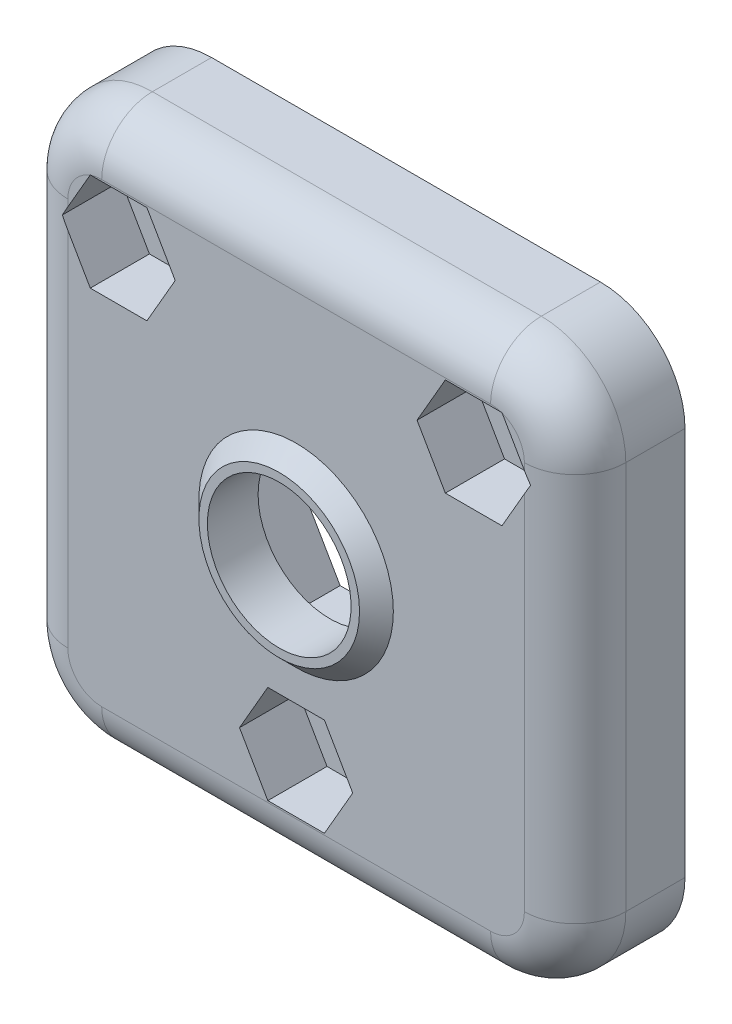
from build123d import *

# Parameters (mm, degrees)
ESBO_O1_R                = 1.75
RESSALTO_EXTRUS_O1_DEPTH = 6.5
CORTE_EXTRUS_O1_DEPTH    = 3.5
CORTE_EXTRUS_O2_DEPTH    = 4.5
ESBO_O3_3_R              = 4.25
CORTE_EXTRUS_O3_DEPTH    = 33.30325061
ESBO_O4_R                = 5.75
ESBO_O4_R_2              = 4.25
RESSALTO_EXTRUS_O2_DEPTH = 1
CHANFRO1_SIZE            = 1
FILETE1_R                = 3


# Some blends are built 0.0001 mm under size
with BuildPart() as part:
    # Esboço1 → Ressalto-extrusão1 (new body)
    with BuildSketch(Plane.XY):
        with BuildLine():
            Line((-11.5, -6), (11.5, -6))
            ThreePointArc((11.5, -6), (15.035533906, -4.535533906), (16.5, -1))
            Line((16.5, -1), (16.5, 22))
            ThreePointArc((16.5, 22), (15.035533906, 25.535533906), (11.5, 27))
            Line((11.5, 27), (-11.5, 27))
            ThreePointArc((-11.5, 27), (-15.035533906, 25.535533906), (-16.5, 22))
            Line((-16.5, 22), (-16.5, -1))
            ThreePointArc((-16.5, -1), (-15.035533906, -4.535533906), (-11.5, -6))
        make_face()
        with Locations(Location((0, 0, 0), (0, 0, 180))):
            Circle(ESBO_O1_R, mode=Mode.SUBTRACT)
        with Locations(Location((-10.5, 21, 0), (0, 0, 180))):
            Circle(ESBO_O1_R, mode=Mode.SUBTRACT)
        with Locations(Location((10.5, 21, 0), (0, 0, 180))):
            Circle(ESBO_O1_R, mode=Mode.SUBTRACT)
    extrude(amount=RESSALTO_EXTRUS_O1_DEPTH)

    # Esboço2 → Corte-extrusão1 (cut)
    with BuildSketch(Plane.XY.offset(6.5)):
        Polygon((-12.174315781, 18.1), (-8.825684219, 18.1), (-7.151368439, 21), (-8.825684219, 23.9), (-12.174315781, 23.9), (-13.848631561, 21), align=None)
        Polygon((8.825684219, 18.1), (12.174315781, 18.1), (13.848631561, 21), (12.174315781, 23.9), (8.825684219, 23.9), (7.151368439, 21), align=None)
        Polygon((-1.674315781, 2.9), (-3.348631561, 0), (-1.674315781, -2.9), (1.674315781, -2.9), (3.348631561, 0), (1.674315781, 2.9), align=None)
    extrude(amount=-CORTE_EXTRUS_O1_DEPTH, mode=Mode.SUBTRACT)

    # Esboço3 → Corte-extrusão2 (cut)
    with BuildSketch(Plane(origin=(0, 0, 0), x_dir=(-1, 0, 0), z_dir=(0, 0, -1))):
        Polygon((3.897114317, 17.25), (-3.897114317, 17.25), (-7.794228634, 10.5), (-3.897114317, 3.75), (3.897114317, 3.75), (7.794228634, 10.5), align=None)
    extrude(amount=-CORTE_EXTRUS_O2_DEPTH, mode=Mode.SUBTRACT)

    # Esboço3<3> → Corte-extrusão3 (cut, through all)
    with BuildSketch(Plane(origin=(0, 0, 0), x_dir=(-1, 0, 0), z_dir=(0, 0, -1))):
        with Locations((0, 10.5)):
            Circle(ESBO_O3_3_R)
    extrude(amount=-CORTE_EXTRUS_O3_DEPTH, mode=Mode.SUBTRACT)

    # Esboço4 → Ressalto-extrusão2 (add)
    with BuildSketch(Plane.XY.offset(6.5)):
        with Locations((0, 10.5)):
            Circle(ESBO_O4_R)
        with Locations(Location((0, 10.5, 0), (0, 0, 180))):
            Circle(ESBO_O4_R_2, mode=Mode.SUBTRACT)
    extrude(amount=RESSALTO_EXTRUS_O2_DEPTH)

    # Chanfro1
    chanfro1_edges = [part.edges().sort_by_distance(p)[0] for p in [
        (-5.75, 10.5, 7.5),
    ]]
    chamfer(chanfro1_edges, length=CHANFRO1_SIZE - 0.0001)  # a hair under: the kernel refuses the full size

    # Filete1
    # the kernel refuses this fillet: 3 mm, written as the material it takes off along each edge
    with BuildSketch(Plane(origin=(11.5, 22, 6.5), x_dir=(1, 0, 0), z_dir=(0, -1, 0))) as filete1_piece_1:
        with BuildLine():
            CenterArc((5 - FILETE1_R, -FILETE1_R), FILETE1_R, 0, 90)
            Line((5, -FILETE1_R), (5, 0))
            Line((5, 0), (5 - FILETE1_R, 0))
        make_face()
    revolve(axis=Axis((11.5, 22, 6.5), (0, 0, 1)), revolution_arc=90, mode=Mode.SUBTRACT)
    with BuildSketch(Plane(origin=(11.5, 27, 6.5), x_dir=(0, -1, 0), z_dir=(-1, 0, 0)), Plane(origin=(-16.5, 22, 6.5), x_dir=(1, 0, 0), z_dir=(0, -1, 0)), Plane(origin=(-11.5, -6, 6.5), x_dir=(0, 1, 0), z_dir=(1, 0, 0)), Plane(origin=(16.5, -1, 6.5), x_dir=(-1, 0, 0), z_dir=(0, 1, 0))) as filete1_piece_2:
        with BuildLine():
            CenterArc((FILETE1_R, -FILETE1_R), FILETE1_R, 90, 90)
            Line((0, -FILETE1_R), (0, 0))
            Line((0, 0), (FILETE1_R, 0))
        make_face()
    extrude(amount=23, mode=Mode.SUBTRACT)
    with BuildSketch(Plane(origin=(-11.5, 22, 6.5), x_dir=(0, 1, 0), z_dir=(1, 0, 0))) as filete1_piece_3:
        with BuildLine():
            CenterArc((5 - FILETE1_R, -FILETE1_R), FILETE1_R, 0, 90)
            Line((5, -FILETE1_R), (5, 0))
            Line((5, 0), (5 - FILETE1_R, 0))
        make_face()
    revolve(axis=Axis((-11.5, 22, 6.5), (0, 0, 1)), revolution_arc=90, mode=Mode.SUBTRACT)
    with BuildSketch(Plane(origin=(-11.5, -1, 6.5), x_dir=(-1, 0, 0), z_dir=(0, 1, 0))) as filete1_piece_4:
        with BuildLine():
            CenterArc((5 - FILETE1_R, -FILETE1_R), FILETE1_R, 0, 90)
            Line((5, -FILETE1_R), (5, 0))
            Line((5, 0), (5 - FILETE1_R, 0))
        make_face()
    revolve(axis=Axis((-11.5, -1, 6.5), (0, 0, 1)), revolution_arc=90, mode=Mode.SUBTRACT)
    with BuildSketch(Plane(origin=(11.5, -1, 6.5), x_dir=(0, -1, 0), z_dir=(-1, 0, 0))) as filete1_piece_5:
        with BuildLine():
            CenterArc((5 - FILETE1_R, -FILETE1_R), FILETE1_R, 0, 90)
            Line((5, -FILETE1_R), (5, 0))
            Line((5, 0), (5 - FILETE1_R, 0))
        make_face()
    revolve(axis=Axis((11.5, -1, 6.5), (0, 0, 1)), revolution_arc=90, mode=Mode.SUBTRACT)


solid = part.part
